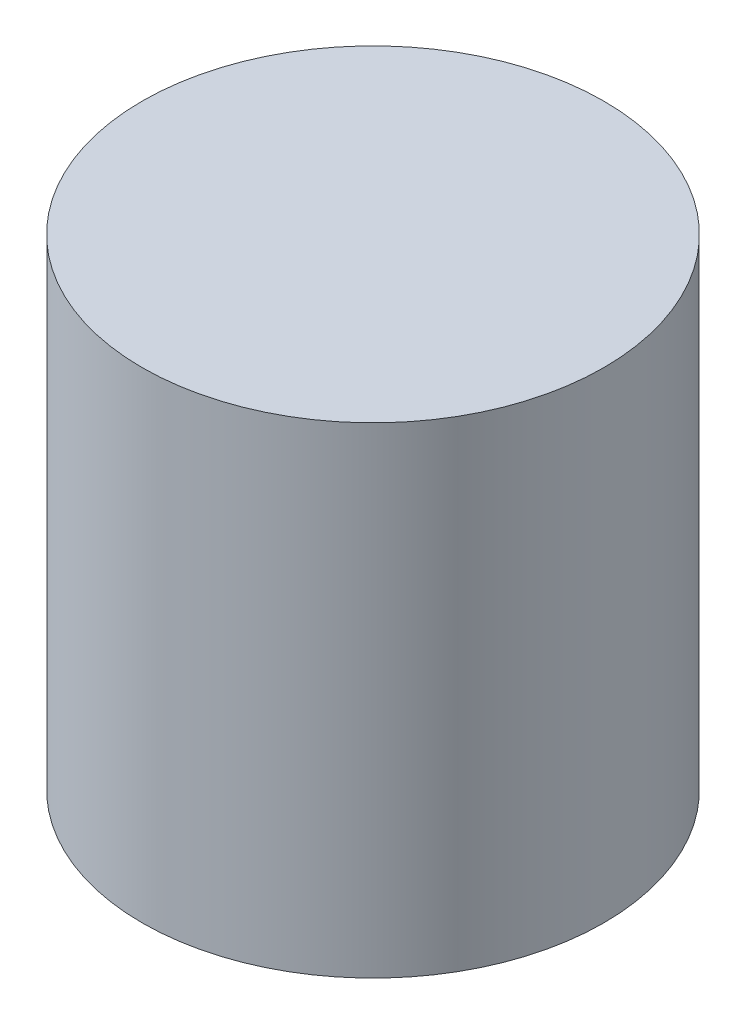
from build123d import *

# Parameters (mm, degrees)
SKETCH1_R           = 4.8
BOSS_EXTRUDE1_DEPTH = 10


with BuildPart() as part:
    # Sketch1 → Boss-Extrude1 (new body)
    with BuildSketch(Plane(origin=(0, 0, 0), x_dir=(1, 0, 0), z_dir=(0, 1, 0))):
        Circle(SKETCH1_R)
    extrude(amount=BOSS_EXTRUDE1_DEPTH)


solid = part.part
